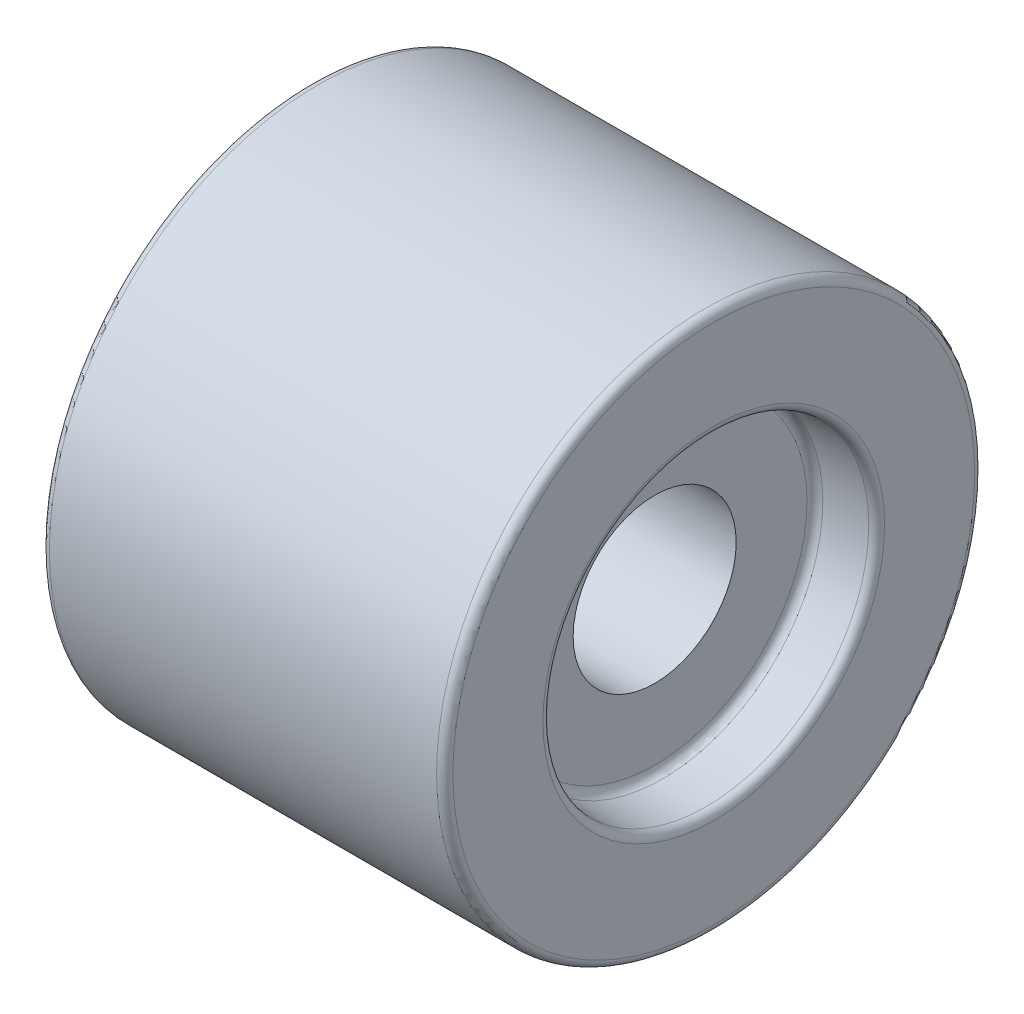
from build123d import *

# Parameters (mm, degrees)
SKETCH_1_W               = 99
SKETCH_1_H               = 66
SKETCH_2_R               = 40
CUT_EXTRUDE_1_DEPTH      = 14.5
CUT_EXTRUDE_1_DRAFT      = -2.9
MIRROR_1_COPY_1_SKETCH_R = 40
MIRROR_1_COPY_1_DEPTH    = 14.5
MIRROR_1_COPY_1_DRAFT    = -2.9
FILLET_1_R               = 2
SKETCH_3_R               = 20
CUT_EXTRUDE_2_DEPTH      = 100


with BuildPart() as part:
    # 草图1 → 旋转2 (revolve)
    with BuildSketch(Plane.XY):
        with Locations((0, 33)):
            Rectangle(SKETCH_1_W, SKETCH_1_H)
    revolve(axis=Axis((-49.5, 0, 0), (1, 0, 0)))


with BuildPart() as cut_extrude_1_tool:
    # 草图2 → 切除-拉伸1 (with draft: the straight prism first)
    with BuildSketch(Plane.ZY.offset(49.5)):
        Circle(SKETCH_2_R)
    extrude(amount=-CUT_EXTRUDE_1_DEPTH)
    # 切除-拉伸1: the draft: its side faces are tilted about the plane it starts from
    cut_extrude_1_sides = [cut_extrude_1_tool.faces().sort_by_distance(p)[0] for p in [
        (-42.25, 0, -40),
    ]]
    draft(cut_extrude_1_sides, Plane.ZY.offset(49.5), CUT_EXTRUDE_1_DRAFT)


with BuildPart() as part_1:
    add(part.part)

    # 切除-拉伸1: cut by cut_extrude_1_tool
    add(cut_extrude_1_tool.part, mode=Mode.SUBTRACT)


with BuildPart() as mirror_1_copy_1_tool:
    # 镜向1 copy 1 sketch → 镜向1 copy 1 (with draft: the straight prism first)
    with BuildSketch(Plane(origin=(49.5, 0, 0), x_dir=(0, 0, 1), z_dir=(1, 0, 0))):
        Circle(MIRROR_1_COPY_1_SKETCH_R)
    extrude(amount=-MIRROR_1_COPY_1_DEPTH)
    # 镜向1 copy 1: the draft: its side faces are tilted about the plane it starts from
    mirror_1_copy_1_sides = [mirror_1_copy_1_tool.faces().sort_by_distance(p)[0] for p in [
        (42.25, 0, -40),
    ]]
    draft(mirror_1_copy_1_sides, Plane(origin=(49.5, 0, 0), x_dir=(0, 0, 1), z_dir=(1, 0, 0)), MIRROR_1_COPY_1_DRAFT)


with BuildPart() as part_2:
    add(part_1.part)

    # 镜向1 copy 1: cut by mirror_1_copy_1_tool
    add(mirror_1_copy_1_tool.part, mode=Mode.SUBTRACT)

    # 圆角1
    fillet_1_edges = [part_2.edges().sort_by_distance(p)[0] for p in [
        (-49.5, -66, 0),
        (35, 0, -39.265461688),
        (49.5, 0, -40),
        (49.5, -66, 0),
        (-35, 0, -39.265461688),
    ]]
    fillet(fillet_1_edges, radius=FILLET_1_R)

    # 草图3 → 切除-拉伸2 (cut)
    with BuildSketch(Plane.ZY.offset(35)):
        Circle(SKETCH_3_R)
    extrude(amount=-CUT_EXTRUDE_2_DEPTH, mode=Mode.SUBTRACT)


solid = part_2.part
